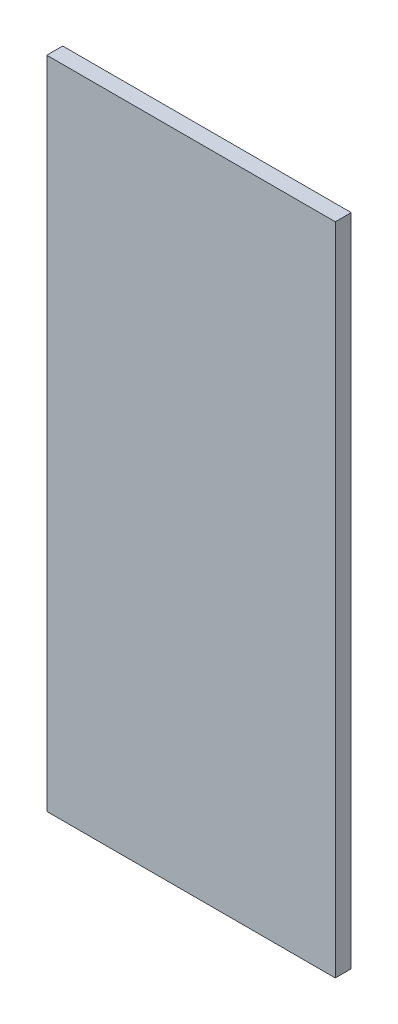
from build123d import *

# Parameters (mm, degrees)
SKETCH1_W           = 163
SKETCH1_H           = 370
BOSS_EXTRUDE1_DEPTH = 9


with BuildPart() as part:
    # Sketch1 → Boss-Extrude1 (new body)
    with BuildSketch(Plane.XY):
        Rectangle(SKETCH1_W, SKETCH1_H)
    extrude(amount=BOSS_EXTRUDE1_DEPTH)


solid = part.part
